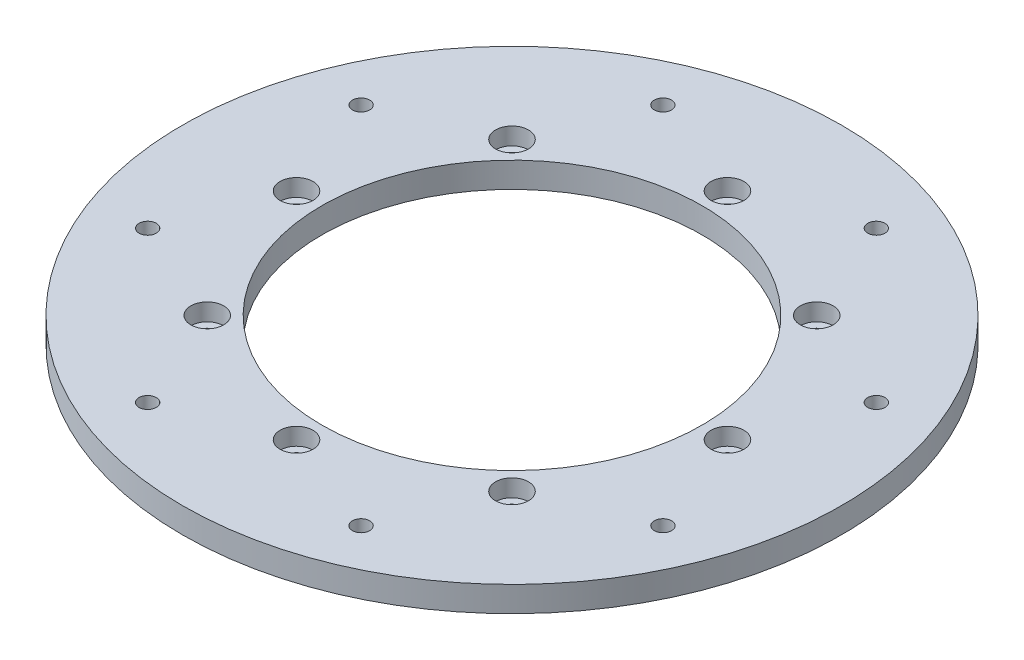
from build123d import *

# Parameters (mm, degrees)
SKETCH1_R                                           = 65
SKETCH1_R_2                                         = 37.5
BOSS_EXTRUDE1_DEPTH                                 = 5
CBORE_FOR_M3_HEX_SOCKET_HEAD_CAP_SCREW1_D           = 3.4
CBORE_FOR_M3_HEX_SOCKET_HEAD_CAP_SCREW1_CBORE_D     = 6.5
CBORE_FOR_M3_HEX_SOCKET_HEAD_CAP_SCREW1_CBORE_DEPTH = 3.4
M3_CLEARANCE_HOLE1_D                                = 3.4


with BuildPart() as part:
    # Sketch1 → Boss-Extrude1 (new body)
    with BuildSketch(Plane(origin=(0, 0, 0), x_dir=(1, 0, 0), z_dir=(0, 1, 0))):
        Circle(SKETCH1_R)
        Circle(SKETCH1_R_2, mode=Mode.SUBTRACT)
    extrude(amount=BOSS_EXTRUDE1_DEPTH)

    # CBORE for M3 Hex Socket Head Cap Screw1 (through all)
    with Locations(Plane(origin=(0, 5, 0), x_dir=(1, 0, 0), z_dir=(0, 1, 0))):
        with Locations((-30.0520382, 30.0520382), (0, 42.5), (30.0520382, 30.0520382), (42.5, 0), (30.0520382, -30.0520382), (0, -42.5), (-30.0520382, -30.0520382), (-42.5, 0)):
            CounterBoreHole(CBORE_FOR_M3_HEX_SOCKET_HEAD_CAP_SCREW1_D / 2, CBORE_FOR_M3_HEX_SOCKET_HEAD_CAP_SCREW1_CBORE_D / 2, CBORE_FOR_M3_HEX_SOCKET_HEAD_CAP_SCREW1_CBORE_DEPTH)

    # M3 Clearance Hole1 (through all)
    with Locations(Plane(origin=(0, 0, 0), x_dir=(-1, 0, 0), z_dir=(0, -1, 0))):
        with Locations((-50.813374288, -21.04758878), (-50.813374288, 21.04758878), (-21.04758878, 50.813374288), (21.04758878, 50.813374288), (50.813374288, 21.04758878), (50.813374288, -21.04758878), (21.04758878, -50.813374288), (-21.04758878, -50.813374288)):
            Hole(M3_CLEARANCE_HOLE1_D / 2)


solid = part.part
